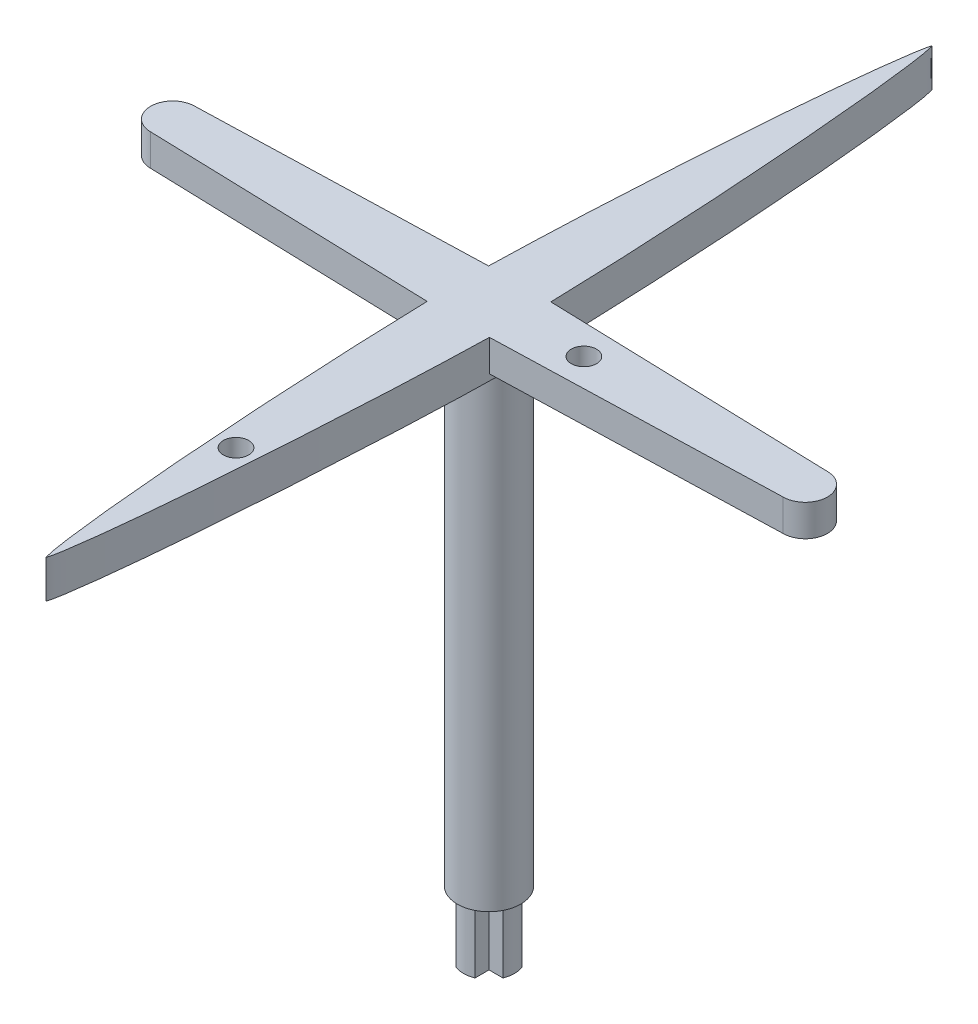
from build123d import *

# Parameters (mm, degrees)
SKETCH_1_R          = 2.5
EXTRUDE_1_DEPTH     = 40
EXTRUDE_2_DEPTH     = 5
EXTRUDE_START       = 40
EXTRUDE_3_DEPTH     = 2.5
SKETCH_4_R          = 1
CUT_EXTRUDE_1_DEPTH = 49.185189633
EXTRUDE_START_2     = 37
EXTRUDE_5_DEPTH     = 3
SKETCH_6_R          = 1
CUT_EXTRUDE_2_DEPTH = 60.502626163


# Read off the part's stored shape, not the designer's step: 凸台-拉伸5
with BuildPart() as part:
    # 草图1 → 凸台-拉伸1 (new body)
    with BuildSketch(Plane(origin=(0, 0, 0), x_dir=(1, 0, 0), z_dir=(0, 1, 0))):
        with Locations(Location((0, 0, 0), (0, 0, 270))):
            Circle(SKETCH_1_R)
    extrude(amount=EXTRUDE_1_DEPTH)

    # 草图2 → 凸台-拉伸2 (add)
    with BuildSketch(Plane(origin=(0, 0, 0), x_dir=(1, 0, 0), z_dir=(0, 1, 0))):
        with BuildLine():
            Line((-1.854049622, 0.75), (-0.75, 0.75))
            Line((-0.75, 0.75), (-0.75, 1.854049622))
            ThreePointArc((-0.75, 1.854049622), (0, 2), (0.75, 1.854049622))
            Line((0.75, 1.854049622), (0.75, 0.75))
            Line((0.75, 0.75), (1.854049622, 0.75))
            ThreePointArc((1.854049622, 0.75), (2, 0), (1.854049622, -0.75))
            Line((1.854049622, -0.75), (0.75, -0.75))
            Line((0.75, -0.75), (0.75, -1.854049622))
            ThreePointArc((0.75, -1.854049622), (0, -2), (-0.75, -1.854049622))
            Line((-0.75, -1.854049622), (-0.75, -0.75))
            Line((-0.75, -0.75), (-1.854049622, -0.75))
            ThreePointArc((-1.854049622, -0.75), (-2, 0), (-1.854049622, 0.75))
        make_face()
    extrude(amount=-EXTRUDE_2_DEPTH)

    # 草图3 → 凸台-拉伸3 (add)
    with BuildSketch(Plane(origin=(0, 0, 0), x_dir=(1, 0, 0), z_dir=(0, 1, 0)).offset(EXTRUDE_START)):
        with BuildLine():
            Line((-25, 1.75), (0, 2.5))
            Line((0, 2.5), (25, 1.75))
            ThreePointArc((25, 1.75), (26.75, 0), (25, -1.75))
            Line((25, -1.75), (0, -2.5))
            Line((0, -2.5), (-25, -1.75))
            ThreePointArc((-25, -1.75), (-26.75, 0), (-25, 1.75))
        make_face()
    extrude(amount=-EXTRUDE_3_DEPTH)

    # 草图4 → 切除-拉伸1 (cut, through all)
    with BuildSketch(Plane(origin=(0, 0, 0), x_dir=(1, 0, 0), z_dir=(0, 1, 0))):
        with Locations(Location((7.5, 0, 0), (0, 0, 270))):
            Circle(SKETCH_4_R)
    extrude(amount=CUT_EXTRUDE_1_DEPTH, mode=Mode.SUBTRACT)

    # 凸台-拉伸5 outline → 凸台-拉伸5 (add)
    with BuildSketch(Plane(origin=(0, 0, 0), x_dir=(1, 0, 0), z_dir=(0, 1, 0)).offset(EXTRUDE_START_2)):
        with BuildLine():
            add(Edge.make_bspline(
                [(2.499933423, 0.018245068), (2.498219386, 0.469363251), (2.484734316, 1.455192602), (2.451884064, 2.975538514), (2.389924718, 5.030093947), (2.311185682, 7.167783743), (2.21992006, 9.304977486), (2.117504763, 11.441661138), (2.004457826, 13.577810113), (1.850297461, 16.247283269), (1.678883113, 18.915719005), (1.489506552, 21.582946653), (1.279504124, 24.248615937), (1.097348525, 26.379992466), (0.89821468, 28.50986205), (0.694476446, 30.469111551), (0.501474971, 32.108411254), (0.335275975, 33.325545367), (0.216484884, 34.069691013), (0.139328591, 34.483174612), (0.092236202, 34.701503032), (0.063236689, 34.819144825), (0.045016629, 34.88495716), (0.032864766, 34.924107989), (0.023980122, 34.950624486), (0.015550639, 34.971928448), (0.009545374, 34.986982697), (0.003698819, 34.995890501), (0, 35)],
                knots=[0.000519485, 0.000519485, 0.000519485, 0.000519485, 0.000519485, 0.051897602, 0.112804134, 0.173710667, 0.2346172, 0.295523733, 0.356430266, 0.417336798, 0.478243331, 0.600056396, 0.660962928, 0.721869461, 0.782775993, 0.843682525, 0.904589058, 0.946207229, 0.970757176, 0.983579314, 0.990404585, 0.994106837, 0.996190511, 0.99737811, 0.9981787, 0.998778686, 0.999368421, 1, 1, 1, 1, 1], degree=4))
            add(Edge.make_bspline(
                [(0, 35), (-0.003698819, 34.995890501), (-0.009545374, 34.986982697), (-0.015550639, 34.971928448), (-0.023980122, 34.950624486), (-0.032864766, 34.924107989), (-0.045016629, 34.88495716), (-0.063236689, 34.819144825), (-0.092236202, 34.701503032), (-0.139328591, 34.483174612), (-0.216484884, 34.069691013), (-0.335275975, 33.325545367), (-0.501474971, 32.108411254), (-0.694476446, 30.469111551), (-0.89821468, 28.50986205), (-1.097348525, 26.379992466), (-1.279504125, 24.248615937), (-1.489506552, 21.582946653), (-1.678883113, 18.915719005), (-1.850297461, 16.247283269), (-2.004457826, 13.577810113), (-2.117504763, 11.441661138), (-2.21992006, 9.304977486), (-2.311185682, 7.167783743), (-2.389924718, 5.030093947), (-2.451884064, 2.975538513), (-2.484734316, 1.455192601), (-2.498219387, 0.46936325), (-2.499933423, 0.018245066)],
                knots=[0, 0, 0, 0, 0, 0.000631579, 0.001221314, 0.0018213, 0.00262189, 0.003809489, 0.005893163, 0.009595415, 0.016420686, 0.029242824, 0.053792771, 0.095410942, 0.156317475, 0.217224007, 0.278130539, 0.339037072, 0.399943604, 0.521756669, 0.582663202, 0.643569734, 0.704476267, 0.7653828, 0.826289333, 0.887195866, 0.948102398, 0.999480515, 0.999480515, 0.999480515, 0.999480515, 0.999480515], degree=4))
            ThreePointArc((-2.499933423, 0.018245066), (-1e-09, 2.5), (2.499933423, 0.018245068))
        make_face()
        with BuildLine():
            ThreePointArc((2.499933423, -0.018245068), (-1e-09, -2.5), (-2.499933423, -0.018245066))
            add(Edge.make_bspline(
                [(-2.499933423, -0.018245066), (-2.498219387, -0.46936325), (-2.484734316, -1.455192601), (-2.451884064, -2.975538513), (-2.389924718, -5.030093947), (-2.311185682, -7.167783743), (-2.21992006, -9.304977486), (-2.117504763, -11.441661138), (-2.004457826, -13.577810113), (-1.850297461, -16.247283269), (-1.678883113, -18.915719005), (-1.489506552, -21.582946653), (-1.279504125, -24.248615937), (-1.097348525, -26.379992466), (-0.89821468, -28.50986205), (-0.694476446, -30.469111551), (-0.501474971, -32.108411254), (-0.335275975, -33.325545367), (-0.216484884, -34.069691013), (-0.139328591, -34.483174612), (-0.092236202, -34.701503032), (-0.063236689, -34.819144825), (-0.045016629, -34.88495716), (-0.032864766, -34.924107989), (-0.023980122, -34.950624486), (-0.015550639, -34.971928448), (-0.009545374, -34.986982697), (-0.003698819, -34.995890501), (0, -35)],
                knots=[0.000519485, 0.000519485, 0.000519485, 0.000519485, 0.000519485, 0.051897602, 0.112804134, 0.173710667, 0.2346172, 0.295523733, 0.356430266, 0.417336798, 0.478243331, 0.600056396, 0.660962928, 0.721869461, 0.782775993, 0.843682525, 0.904589058, 0.946207229, 0.970757176, 0.983579314, 0.990404585, 0.994106837, 0.996190511, 0.99737811, 0.9981787, 0.998778686, 0.999368421, 1, 1, 1, 1, 1], degree=4))
            add(Edge.make_bspline(
                [(0, -35), (0.003698819, -34.995890501), (0.009545374, -34.986982697), (0.015550639, -34.971928448), (0.023980122, -34.950624486), (0.032864766, -34.924107989), (0.045016629, -34.88495716), (0.063236689, -34.819144825), (0.092236202, -34.701503032), (0.139328591, -34.483174612), (0.216484884, -34.069691013), (0.335275975, -33.325545367), (0.501474971, -32.108411254), (0.694476446, -30.469111551), (0.89821468, -28.50986205), (1.097348525, -26.379992466), (1.279504124, -24.248615937), (1.489506552, -21.582946653), (1.678883113, -18.915719005), (1.850297461, -16.247283269), (2.004457826, -13.577810113), (2.117504763, -11.441661138), (2.21992006, -9.304977486), (2.311185682, -7.167783743), (2.389924718, -5.030093947), (2.451884064, -2.975538514), (2.484734316, -1.455192602), (2.498219386, -0.469363251), (2.499933423, -0.018245068)],
                knots=[0, 0, 0, 0, 0, 0.000631579, 0.001221314, 0.0018213, 0.00262189, 0.003809489, 0.005893163, 0.009595415, 0.016420686, 0.029242824, 0.053792771, 0.095410942, 0.156317475, 0.217224007, 0.278130539, 0.339037072, 0.399943604, 0.521756669, 0.582663202, 0.643569734, 0.704476267, 0.7653828, 0.826289333, 0.887195866, 0.948102398, 0.999480515, 0.999480515, 0.999480515, 0.999480515, 0.999480515], degree=4))
        make_face()
    extrude(amount=EXTRUDE_5_DEPTH)

    # 草图6 → 切除-拉伸2 (cut, through all)
    with BuildSketch(Plane(origin=(0, 0, 0), x_dir=(1, 0, 0), z_dir=(0, 1, 0))):
        with Locations(Location((0, -20, 0), (0, 0, 90))):
            Circle(SKETCH_6_R)
    extrude(amount=CUT_EXTRUDE_2_DEPTH, mode=Mode.SUBTRACT)


solid = part.part
